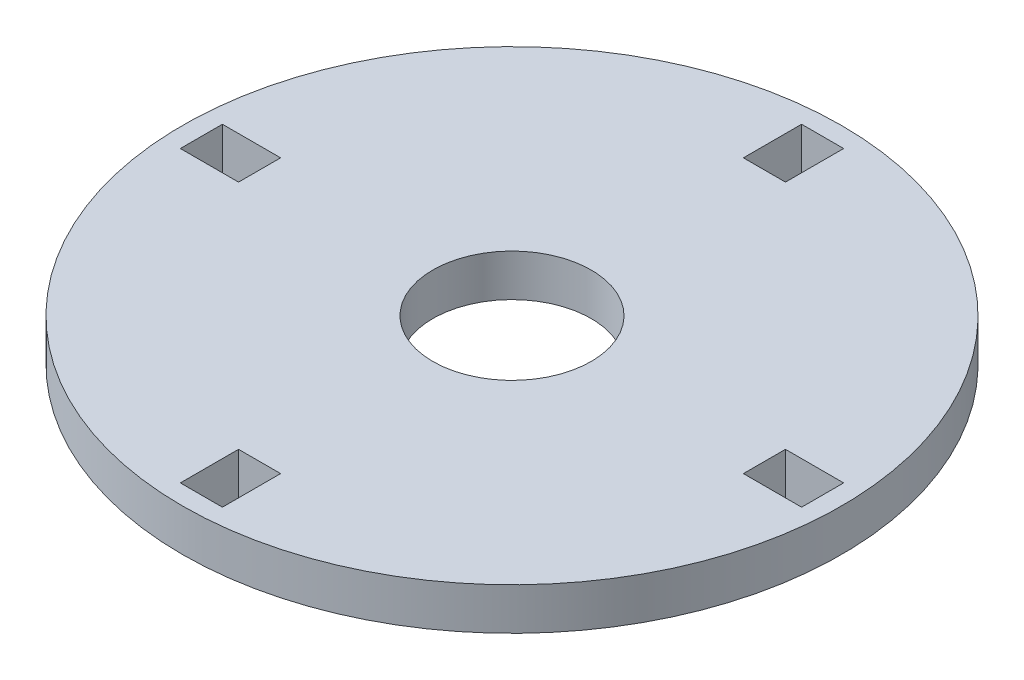
from build123d import *

# Parameters (mm, degrees)
SKICA1_R                 = 23.5
P_IDAT_VYSUNUT_M1_DEPTH  = 3
SKICA2_R                 = 5.65
ODEBRAT_VYSUNUT_M1_DEPTH = 3
SKICA3_W                 = 4.15
SKICA3_H                 = 3
SKICA3_W_2               = 3
SKICA3_H_2               = 4.15
ODEBRAT_VYSUNUT_M2_DEPTH = 3


with BuildPart() as part:
    # Skica1 → Přidat vysunutím1 (new body)
    with BuildSketch(Plane(origin=(0, 0, 0), x_dir=(1, 0, 0), z_dir=(0, 1, 0))):
        Circle(SKICA1_R)
    extrude(amount=P_IDAT_VYSUNUT_M1_DEPTH)

    # Skica2 → Odebrat vysunutím1 (cut)
    with BuildSketch(Plane(origin=(0, 3, 0), x_dir=(1, 0, 0), z_dir=(0, 1, 0))):
        Circle(SKICA2_R)
    extrude(amount=-ODEBRAT_VYSUNUT_M1_DEPTH, mode=Mode.SUBTRACT)

    # Skica3 → Odebrat vysunutím2 (cut)
    with BuildSketch(Plane.XZ):
        with Locations((20.075, 0)):
            Rectangle(SKICA3_W, SKICA3_H)
        with Locations((0, 20.075)):
            Rectangle(SKICA3_W_2, SKICA3_H_2)
        with Locations((0, -20.075)):
            Rectangle(SKICA3_W_2, SKICA3_H_2)
        with Locations((-20.075, 0)):
            Rectangle(SKICA3_W, SKICA3_H)
    extrude(amount=-ODEBRAT_VYSUNUT_M2_DEPTH, mode=Mode.SUBTRACT)


solid = part.part
